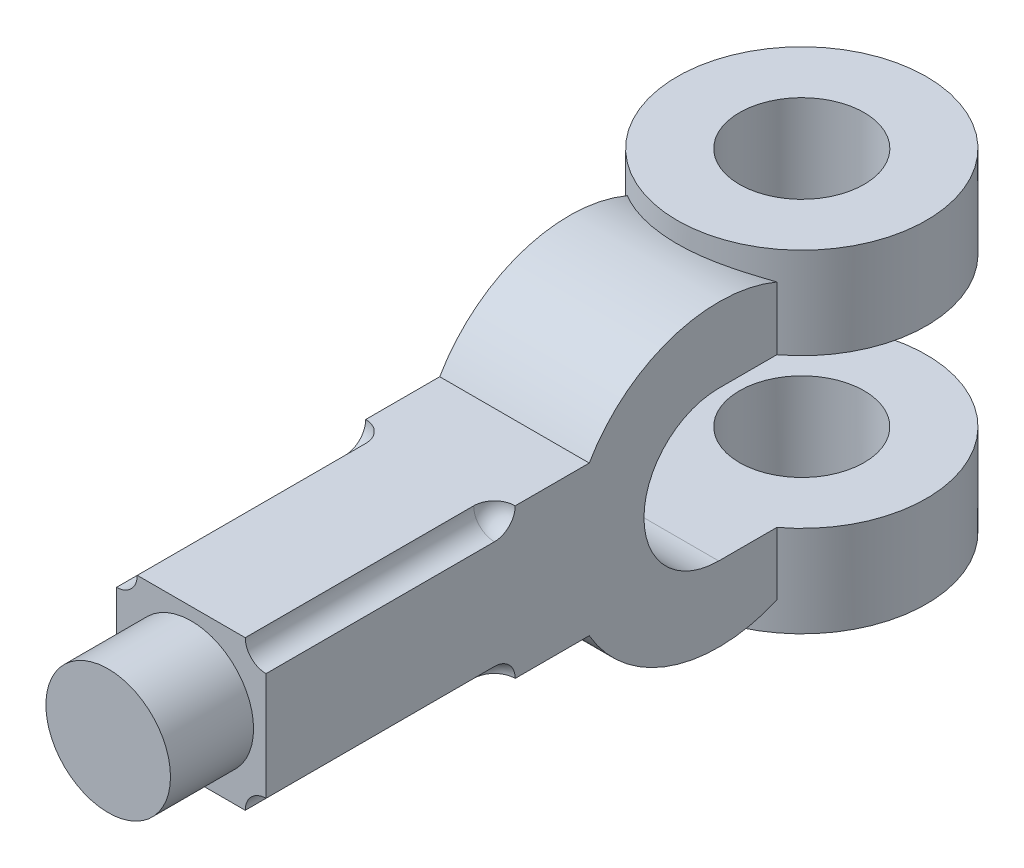
from build123d import *

# Parameters (mm, degrees)
SKETCH1_R                = 36
BOSS_EXTRUDE1_DEPTH      = 18
SKETCH2_W                = 36
SKETCH2_H                = 36
BOSS_EXTRUDE2_DEPTH      = 109
SKETCH3_R                = 15
BOSS_EXTRUDE3_DEPTH      = 20
SKETCH4_R                = 30
BOSS_EXTRUDE4_DEPTH      = 40
CUT_EXTRUDE1_DEPTH       = 139.351002938
CUT_EXTRUDE1_DEPTH_BACK  = 139.351002938
HOLE1_D                  = 30
CUT_EXTRUDE2_START       = -60
CUT_EXTRUDE2_DEPTH       = 244.926615935
FILLET1_R                = 5
CIRPATTERN1_COUNT        = 4
FILLET1_OF_CIRPATTERN1_R = 5


with BuildPart() as part:
    # Sketch1 → Boss-Extrude1 (new, symmetric)
    with BuildSketch(Plane(origin=(0, 0, 0), x_dir=(0, 0, -1), z_dir=(1, 0, 0))):
        Circle(SKETCH1_R)
    extrude(amount=BOSS_EXTRUDE1_DEPTH, both=True)

    # Sketch2 → Boss-Extrude2 (add)
    with BuildSketch(Plane.XY):
        Rectangle(SKETCH2_W, SKETCH2_H)
    extrude(amount=BOSS_EXTRUDE2_DEPTH)

    # Sketch3 → Boss-Extrude3 (add)
    with BuildSketch(Plane.XY.offset(109)):
        Circle(SKETCH3_R)
    extrude(amount=BOSS_EXTRUDE3_DEPTH)

    # Sketch4 → Boss-Extrude4 (add, symmetric)
    with BuildSketch(Plane(origin=(0, 0, 0), x_dir=(1, 0, 0), z_dir=(0, 1, 0))):
        with Locations(Location((0, 38, 0), (0, 0, 270))):
            Circle(SKETCH4_R)
    extrude(amount=BOSS_EXTRUDE4_DEPTH, both=True)

    # Sketch5 → Cut-Extrude1 (cut, two sides: drawn at the far end of the back side and taken through both)
    with BuildSketch(Plane(origin=(0, 0, 0), x_dir=(0, 0, -1), z_dir=(1, 0, 0)).offset(-CUT_EXTRUDE1_DEPTH_BACK)):
        with BuildLine():
            Line((0, 18), (68, 18))
            Line((68, 18), (68, -18))
            Line((68, -18), (0, -18))
            ThreePointArc((0, -18), (-18, 0), (0, 18))
        make_face()
    extrude(amount=CUT_EXTRUDE1_DEPTH + CUT_EXTRUDE1_DEPTH_BACK, mode=Mode.SUBTRACT)

    # Hole1 (through all)
    with Locations(Plane(origin=(0, 40, 0), x_dir=(1, 0, 0), z_dir=(0, 1, 0))):
        with Locations((0, 38)):
            Hole(HOLE1_D / 2)

    # Sketch8 → Cut-Extrude2 (cut)
    with BuildSketch(Plane.XY.offset(109).offset(CUT_EXTRUDE2_START)):
        with BuildLine():
            Line((13, 18), (18, 18))
            Line((18, 18), (18, 13))
            ThreePointArc((18, 13), (14.464466094, 14.464466094), (13, 18))
        make_face()
    cut_extrude2 = extrude(amount=CUT_EXTRUDE2_DEPTH, mode=Mode.SUBTRACT)

    # Fillet1
    fillet1_edges = [part.edges().sort_by_distance(p)[0] for p in [
        (14.464466094, 14.464466094, 49),
    ]]
    fillet(fillet1_edges, radius=FILLET1_R - 0.0001)  # a hair under: the kernel refuses the full size

    # CirPattern1: Cut-Extrude2 ×4 about axis
    cirpattern1_axis = Axis((0, 0, 0), (0, 0, 1))
    for i in range(1, CIRPATTERN1_COUNT):
        add(cut_extrude2.rotate(cirpattern1_axis, i * 360 / CIRPATTERN1_COUNT), mode=Mode.SUBTRACT)

    # Fillet1 of CirPattern1
    fillet1_of_cirpattern1_edges = [part.edges().sort_by_distance(p)[0] for p in [
        (-14.464466094, 14.464466094, 49),
        (-14.464466094, -14.464466094, 49),
        (14.464466094, -14.464466094, 49),
    ]]
    fillet(fillet1_of_cirpattern1_edges, radius=FILLET1_OF_CIRPATTERN1_R - 0.0001)  # a hair under: the kernel refuses the full size


solid = part.part
